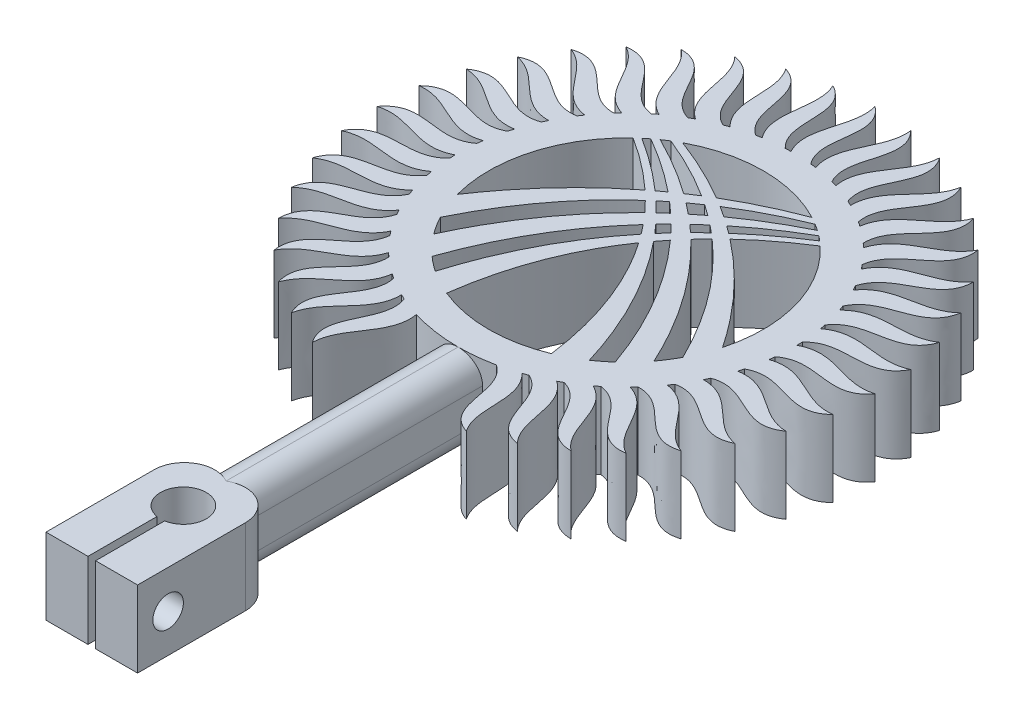
from build123d import *

# Parameters (mm, degrees)
SKETCH1_W           = 6
SKETCH1_H           = 9
BASE_DEPTH          = 5
SKETCH8_W           = 3
SKETCH8_H           = 16
HANDLE_DEPTH        = 5
SKETCH9_R           = 1.5
MOTOR_HOLE_DEPTH    = 5
SKETCH12_R          = 1
SCREW_HOLE_DEPTH    = 6
SKETCH13_W          = 0.50162232
SKETCH13_H          = 6
PINCH_CLAMP_DEPTH   = 5
SKETCH14_R          = 11
KYRGYZ_FLAG_DEPTH   = 5
SKETCH17_R          = 9
INSIDE_CIRCLE_DEPTH = 5
TUNDUK_LEFT_DEPTH   = 5
SUNRAY_DEPTH        = 5
CIRPATTERN1_COUNT   = 40
FILLET1_R           = 2
FILLET2_R           = 2
FILLET4_R           = 1.5
FILLET5_R           = 1.5
FILLET6_R           = 1.5
FILLET7_R           = 1.5


# Some blends are built 0.0001 mm under size
with BuildPart() as part:
    # Sketch1 → Base (new body)
    with BuildSketch(Plane(origin=(0, 0, 0), x_dir=(1, 0, 0), z_dir=(0, 1, 0))):
        with Locations((3, -4.5)):
            Rectangle(SKETCH1_W, SKETCH1_H)
    extrude(amount=BASE_DEPTH)

    # Sketch8 → Handle (add)
    with BuildSketch(Plane(origin=(0, 0, 0), x_dir=(1, 0, 0), z_dir=(0, 1, 0))):
        with Locations((3, 8)):
            Rectangle(SKETCH8_W, SKETCH8_H)
    extrude(amount=HANDLE_DEPTH)

    # Sketch9 → Motor Hole (cut)
    with BuildSketch(Plane(origin=(0, 0, 0), x_dir=(1, 0, 0), z_dir=(0, 1, 0))):
        with Locations(Location((3, -3, 0), (0, 0, 270))):
            Circle(SKETCH9_R)
    extrude(amount=MOTOR_HOLE_DEPTH, mode=Mode.SUBTRACT)

    # Sketch12 → Screw Hole (cut)
    with BuildSketch(Plane(origin=(0, 0, 0), x_dir=(0, 0, -1), z_dir=(1, 0, 0))):
        with Locations((-7, 2.5)):
            Circle(SKETCH12_R)
    extrude(amount=SCREW_HOLE_DEPTH, mode=Mode.SUBTRACT)

    # Sketch13 → Pinch Clamp (cut)
    with BuildSketch(Plane(origin=(0, 0, 0), x_dir=(1, 0, 0), z_dir=(0, 1, 0))):
        with Locations((3, -6)):
            Rectangle(SKETCH13_W, SKETCH13_H)
    extrude(amount=PINCH_CLAMP_DEPTH, mode=Mode.SUBTRACT)


with BuildPart() as body_2:
    # Sketch14 → Kyrgyz Flag (new body)
    with BuildSketch(Plane(origin=(0, 0, 0), x_dir=(1, 0, 0), z_dir=(0, 1, 0))):
        with Locations(Location((3, 26, 0), (0, 0, 270))):
            Circle(SKETCH14_R)
    extrude(amount=KYRGYZ_FLAG_DEPTH)

    # Sketch17 → Inside Circle (cut)
    with BuildSketch(Plane(origin=(0, 0, 0), x_dir=(1, 0, 0), z_dir=(0, 1, 0))):
        with Locations(Location((3, 26, 0), (0, 0, 270))):
            Circle(SKETCH17_R)
    extrude(amount=INSIDE_CIRCLE_DEPTH, mode=Mode.SUBTRACT)

    # Sketch18 → Tunduk Left (add)
    with BuildSketch(Plane(origin=(0, 0, 0), x_dir=(1, 0, 0), z_dir=(0, 1, 0))):
        with BuildLine():
            ThreePointArc((9.127166527, 32.592255331), (8.97803832, 32.727782536), (8.825913208, 32.859936974))
            add(Edge.make_bspline(
                [(-2.047915789, 18.548923152), (0.750364904, 27.763674197), (8.825913208, 32.859936974)],
                knots=[0, 0, 0, 1, 1, 1], degree=2))
            ThreePointArc((-2.047915789, 18.548923152), (-1.262653221, 18.073475697), (-0.433043925, 17.680492238))
            add(Edge.make_bspline(
                [(-0.433043925, 17.680492238), (0.85852816, 27.336897123), (9.127166527, 32.592255331)],
                knots=[0, 0, 0, 1, 1, 1], degree=2))
        make_face()
        with BuildLine():
            ThreePointArc((-5.68461679, 23.638341427), (-5.367767941, 22.686322331), (-4.9469177, 21.775488303))
            add(Edge.make_bspline(
                [(-4.9469177, 21.775488303), (-0.812392501, 30.228026867), (7.722640319, 33.6613751)],
                knots=[0, 0, 0, 1, 1, 1], degree=2))
            ThreePointArc((7.722640319, 33.6613751), (7.479908479, 33.805794003), (7.232764451, 33.942525108))
            add(Edge.make_bspline(
                [(-5.68461679, 23.638341427), (-0.796325397, 30.905707307), (7.232764451, 33.942525108)],
                knots=[0, 0, 0, 1, 1, 1], degree=2))
        make_face()
        with BuildLine():
            ThreePointArc((8.49924922, 33.124483), (8.324452662, 33.25604602), (8.146509901, 33.383321464))
            add(Edge.make_bspline(
                [(-4.211971644, 20.615999163), (-0.248355431, 29.214403671), (8.146509901, 33.383321464)],
                knots=[0, 0, 0, 1, 1, 1], degree=2))
            ThreePointArc((-4.211971644, 20.615999163), (-3.639414336, 19.923966978), (-3.000730886, 19.292449863))
            add(Edge.make_bspline(
                [(-3.000730886, 19.292449863), (0.188444983, 28.332385329), (8.49924922, 33.124483)],
                knots=[0, 0, 0, 1, 1, 1], degree=2))
        make_face()
    tunduk_left = extrude(amount=TUNDUK_LEFT_DEPTH)

    # Tunduk Right: Tunduk Left across plane
    add(tunduk_left.mirror(Plane(origin=(3, 0, 0), x_dir=(0, 0, 1), z_dir=(1, 0, 0))))

    # Sketch26 → Sunray (add)
    with BuildSketch(Plane(origin=(0, 0, 0), x_dir=(1, 0, 0), z_dir=(0, 1, 0))):
        with BuildLine():
            ThreePointArc((4.166812649, 36.937940768), (3.487182562, 36.989206211), (2.805682157, 36.998283529))
            add(Edge.make_bspline(
                [(3, 42.303288996), (3.536596213, 40.466720942), (1.827018473, 38.843105657), (2.805682157, 36.998283529)],
                knots=[0, 0, 0, 0, 1, 1, 1, 1], degree=3))
            add(Edge.make_bspline(
                [(4.166812649, 36.937940768), (2.854146779, 38.634596005), (4.912183024, 40.891501584), (3, 42.303288996)],
                knots=[0, 0, 0, 0, 1, 1, 1, 1], degree=3))
        make_face()
    sunray = extrude(amount=SUNRAY_DEPTH)

    # Combine2: union part
    add(part.part)

    # CirPattern1: Sunray ×40 about axis, 3 skipped
    cirpattern1_axis = Axis((3, 27.507980814, -26), (0, -1, 0))
    add([sunray.rotate(cirpattern1_axis, i * 360 / CIRPATTERN1_COUNT) for i in range(1, CIRPATTERN1_COUNT) if i not in (19, 20, 21)])

    # Fillet1
    # the kernel refuses this fillet: 2 mm, written as the material it takes off along each edge
    with BuildSketch(Plane(origin=(6, -4.841229183, 0), x_dir=(0, 0, 1), z_dir=(0, 1, 0))) as fillet1_piece_1:
        with BuildLine():
            CenterArc((1.936491673, -2), FILLET1_R, 90, 75.522487814)
            Line((0, -1.5), (-0.038729833, -1.49))
            ThreePointArc((-0.038729833, -1.49), (-0.04, -0.75), (-0.04, 0))
            Line((-0.04, 0), (0, 0.04))
            Line((0, 0.04), (1.936491673, 0.04))
            Line((1.936491673, 0.04), (1.936491673, 0))
        make_face()
    extrude(amount=14.682458366, mode=Mode.SUBTRACT)

    # Fillet2
    # the kernel refuses this fillet: 2 mm, written as the material it takes off along each edge
    with BuildSketch(Plane(origin=(0, -4.841229183, 0), x_dir=(0, 0, 1), z_dir=(0, 1, 0))) as fillet2_piece_1:
        with BuildLine():
            CenterArc((1.936491673, 2), FILLET2_R, 194.477512186, 75.522487814)
            Line((0, 1.5), (-0.038729833, 1.49))
            ThreePointArc((-0.038729833, 1.49), (-0.04, 0.75), (-0.04, 0))
            Line((-0.04, 0), (0, -0.04))
            Line((0, -0.04), (1.936491673, -0.04))
            Line((1.936491673, -0.04), (1.936491673, 0))
        make_face()
    extrude(amount=14.682458366, mode=Mode.SUBTRACT)

    # Fillet4
    fillet4_edges = [body_2.edges().sort_by_distance(p)[0] for p in [
        (1.5, 5, -7.551376321),
    ]]
    fillet(fillet4_edges, radius=FILLET4_R)

    # Fillet5
    fillet5_edges = [body_2.edges().sort_by_distance(p)[0] for p in [
        (4.5, 5, -7.551376321),
    ]]
    fillet(fillet5_edges, radius=FILLET5_R - 0.0001)  # a hair under: the kernel refuses the full size

    # Fillet6
    fillet6_edges = [body_2.edges().sort_by_distance(p)[0] for p in [
        (4.5, 0, -7.551376321),
    ]]
    fillet(fillet6_edges, radius=FILLET6_R)

    # Fillet7
    fillet7_edges = [body_2.edges().sort_by_distance(p)[0] for p in [
        (1.5, 0, -7.551376321),
    ]]
    fillet(fillet7_edges, radius=FILLET7_R - 0.0001)  # a hair under: the kernel refuses the full size


solid = body_2.part
